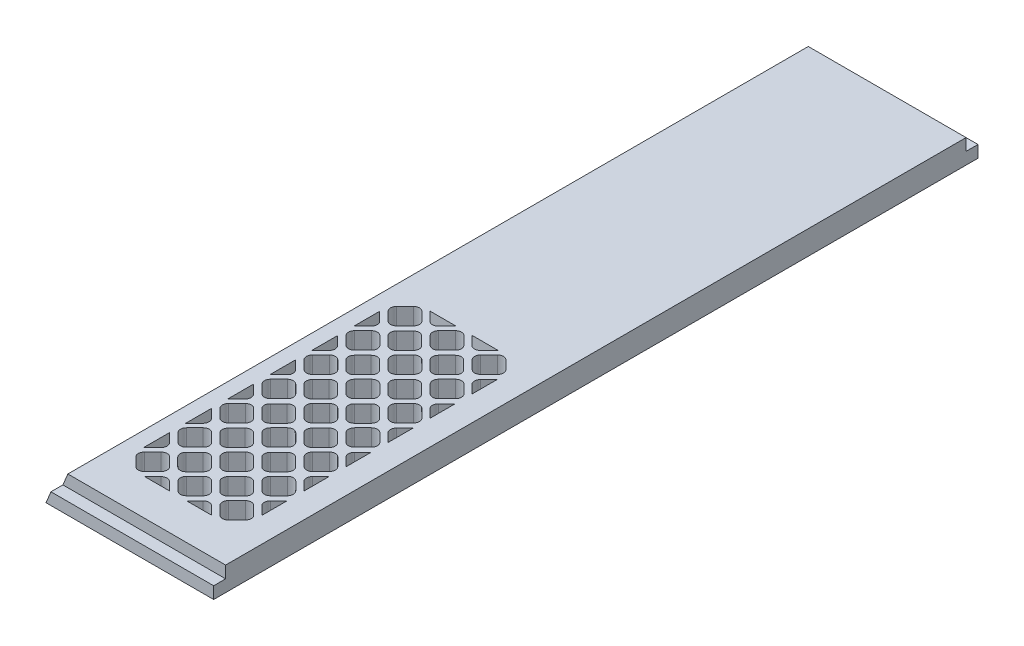
from build123d import *

# Parameters (mm, degrees)
BOSS_EXTRUDE1_DEPTH = 406.4
SKETCH2_W           = 89.154
SKETCH2_H           = 6.35
CUT_EXTRUDE1_DEPTH  = 6.35
CUT_EXTRUDE2_DEPTH  = 417.257955739


with BuildPart() as part:
    # Sketch1 → Boss-Extrude1 (new body)
    with BuildSketch(Plane.XY):
        Polygon((0, 0), (5.260512242, 12.7), (89.154, 12.7), (89.154, 0), align=None)
    extrude(amount=BOSS_EXTRUDE1_DEPTH)

    # Sketch2 → Cut-Extrude1 (cut)
    with BuildSketch(Plane.XZ.offset(-12.7)):
        with Locations((44.577, 3.175)):
            Rectangle(SKETCH2_W, SKETCH2_H)
        with Locations((44.577, 403.225)):
            Rectangle(SKETCH2_W, SKETCH2_H)
    extrude(amount=CUT_EXTRUDE1_DEPTH, mode=Mode.SUBTRACT)

    # Sketch3 → Cut-Extrude2 (cut, through all)
    with BuildSketch(Plane.XZ):
        with BuildLine():
            Line((13.244743879, 255.975205334), (13.244743879, 242.242295027))
            ThreePointArc((13.244743879, 242.242295027), (13.315448739, 242.306875127), (13.384173908, 242.37355809))
            Line((13.384173908, 242.37355809), (17.874301968, 246.863686151))
            ThreePointArc((17.874301968, 246.863686151), (18.804237938, 249.108750181), (17.874301968, 251.353814211))
            Line((17.874301968, 251.353814211), (13.384173908, 255.843942271))
            ThreePointArc((13.384173908, 255.843942271), (13.315448739, 255.910625234), (13.244743879, 255.975205334))
        make_face()
        with BuildLine():
            ThreePointArc((26.755917787, 229.001814211), (26.645338589, 228.885498635), (26.54077831, 228.763743879))
            Line((26.54077831, 228.763743879), (40.441441445, 228.763743879))
            ThreePointArc((40.441441445, 228.763743879), (40.336881166, 228.885498635), (40.226301968, 229.001814211))
            Line((40.226301968, 229.001814211), (35.736173908, 233.491942271))
            ThreePointArc((35.736173908, 233.491942271), (33.491109878, 234.421878241), (31.246045847, 233.491942271))
            Line((31.246045847, 233.491942271), (26.755917787, 229.001814211))
        make_face()
        with BuildLine():
            Line((13.244743879, 278.327205334), (13.244743879, 264.594295027))
            ThreePointArc((13.244743879, 264.594295027), (13.315448739, 264.658875127), (13.384173908, 264.72555809))
            Line((13.384173908, 264.72555809), (17.874301968, 269.215686151))
            ThreePointArc((17.874301968, 269.215686151), (18.804237938, 271.460750181), (17.874301968, 273.705814211))
            Line((17.874301968, 273.705814211), (13.384173908, 278.195942271))
            ThreePointArc((13.384173908, 278.195942271), (13.315448739, 278.262625234), (13.244743879, 278.327205334))
        make_face()
        with BuildLine():
            ThreePointArc((49.107917787, 229.001814211), (48.997338588, 228.885498635), (48.89277831, 228.763743879))
            Line((48.89277831, 228.763743879), (62.793441445, 228.763743879))
            ThreePointArc((62.793441445, 228.763743879), (62.688881166, 228.885498635), (62.578301968, 229.001814211))
            Line((62.578301968, 229.001814211), (58.088173908, 233.491942271))
            ThreePointArc((58.088173908, 233.491942271), (55.843109877, 234.421878241), (53.598045847, 233.491942271))
            Line((53.598045847, 233.491942271), (49.107917787, 229.001814211))
        make_face()
        with BuildLine():
            Line((13.244743879, 300.679205334), (13.244743879, 286.946295027))
            ThreePointArc((13.244743879, 286.946295027), (13.315448739, 287.010875127), (13.384173908, 287.07755809))
            Line((13.384173908, 287.07755809), (17.874301968, 291.56768615))
            ThreePointArc((17.874301968, 291.56768615), (18.804237938, 293.812750181), (17.874301968, 296.057814211))
            Line((17.874301968, 296.057814211), (13.384173908, 300.547942271))
            ThreePointArc((13.384173908, 300.547942271), (13.315448739, 300.614625234), (13.244743879, 300.679205334))
        make_face()
        with BuildLine():
            Line((13.244743879, 323.031205334), (13.244743879, 309.298295027))
            ThreePointArc((13.244743879, 309.298295027), (13.315448739, 309.362875127), (13.384173908, 309.42955809))
            Line((13.384173908, 309.42955809), (17.874301968, 313.91968615))
            ThreePointArc((17.874301968, 313.91968615), (18.804237938, 316.16475018), (17.874301968, 318.409814211))
            Line((17.874301968, 318.409814211), (13.384173908, 322.899942271))
            ThreePointArc((13.384173908, 322.899942271), (13.315448739, 322.966625234), (13.244743879, 323.031205334))
        make_face()
        with BuildLine():
            Line((71.459917787, 246.86368615), (75.909256121, 242.414347816))
            Line((75.909256121, 242.414347816), (75.909256121, 255.803152545))
            Line((75.909256121, 255.803152545), (71.459917787, 251.353814211))
            ThreePointArc((71.459917787, 251.353814211), (70.529981817, 249.108750181), (71.459917787, 246.86368615))
        make_face()
        with BuildLine():
            Line((13.244743879, 345.383205334), (13.244743879, 331.650295027))
            ThreePointArc((13.244743879, 331.650295027), (13.315448739, 331.714875127), (13.384173908, 331.78155809))
            Line((13.384173908, 331.78155809), (17.874301968, 336.27168615))
            ThreePointArc((17.874301968, 336.27168615), (18.804237938, 338.51675018), (17.874301968, 340.761814211))
            Line((17.874301968, 340.761814211), (13.384173908, 345.251942271))
            ThreePointArc((13.384173908, 345.251942271), (13.315448739, 345.318625234), (13.244743879, 345.383205334))
        make_face()
        with BuildLine():
            Line((71.459917786, 269.21568615), (75.909256121, 264.766347816))
            Line((75.909256121, 264.766347816), (75.909256121, 278.155152546))
            Line((75.909256121, 278.155152546), (71.459917786, 273.705814211))
            ThreePointArc((71.459917786, 273.705814211), (70.529981817, 271.460750181), (71.459917786, 269.21568615))
        make_face()
        with BuildLine():
            Line((13.244743879, 367.735205334), (13.244743879, 354.002295027))
            ThreePointArc((13.244743879, 354.002295027), (13.315448739, 354.066875126), (13.384173908, 354.13355809))
            Line((13.384173908, 354.13355809), (17.874301968, 358.62368615))
            ThreePointArc((17.874301968, 358.62368615), (18.804237938, 360.86875018), (17.874301968, 363.113814211))
            Line((17.874301968, 363.113814211), (13.384173908, 367.603942271))
            ThreePointArc((13.384173908, 367.603942271), (13.315448739, 367.670625234), (13.244743879, 367.735205334))
        make_face()
        with BuildLine():
            Line((71.459917786, 291.56768615), (75.909256121, 287.118347816))
            Line((75.909256121, 287.118347816), (75.909256121, 300.507152545))
            Line((75.909256121, 300.507152545), (71.459917786, 296.057814211))
            ThreePointArc((71.459917786, 296.057814211), (70.529981817, 293.812750181), (71.459917786, 291.56768615))
        make_face()
        with BuildLine():
            Line((71.459917786, 313.91968615), (75.909256121, 309.470347816))
            Line((75.909256121, 309.470347816), (75.909256121, 322.859152545))
            Line((75.909256121, 322.859152545), (71.459917786, 318.409814211))
            ThreePointArc((71.459917786, 318.409814211), (70.529981817, 316.164750181), (71.459917786, 313.91968615))
        make_face()
        with BuildLine():
            Line((40.086871939, 380.836256121), (26.895347816, 380.836256121))
            Line((26.895347816, 380.836256121), (31.246045847, 376.485558089))
            ThreePointArc((31.246045847, 376.485558089), (33.491109877, 375.55562212), (35.736173908, 376.485558089))
            Line((35.736173908, 376.485558089), (40.086871939, 380.836256121))
        make_face()
        with BuildLine():
            Line((71.459917787, 336.27168615), (75.909256121, 331.822347816))
            Line((75.909256121, 331.822347816), (75.909256121, 345.211152545))
            Line((75.909256121, 345.211152545), (71.459917787, 340.761814211))
            ThreePointArc((71.459917787, 340.761814211), (70.529981817, 338.51675018), (71.459917787, 336.27168615))
        make_face()
        with BuildLine():
            Line((62.438871939, 380.836256121), (49.247347815, 380.836256121))
            Line((49.247347815, 380.836256121), (53.598045847, 376.485558089))
            ThreePointArc((53.598045847, 376.485558089), (55.843109877, 375.55562212), (58.088173908, 376.485558089))
            Line((58.088173908, 376.485558089), (62.438871939, 380.836256121))
        make_face()
        with BuildLine():
            Line((71.459917787, 358.62368615), (75.909256121, 354.174347816))
            Line((75.909256121, 354.174347816), (75.909256121, 367.563152545))
            Line((75.909256121, 367.563152545), (71.459917787, 363.113814211))
            ThreePointArc((71.459917787, 363.113814211), (70.529981817, 360.86875018), (71.459917787, 358.62368615))
        make_face()
        with BuildLine():
            Line((53.598045847, 255.843942272), (49.107917787, 251.353814211))
            ThreePointArc((49.107917787, 251.353814211), (48.177981817, 249.108750181), (49.107917787, 246.863686151))
            Line((49.107917787, 246.863686151), (53.598045847, 242.37355809))
            ThreePointArc((53.598045847, 242.37355809), (55.843109877, 241.44362212), (58.088173908, 242.37355809))
            Line((58.088173908, 242.37355809), (62.578301968, 246.863686151))
            ThreePointArc((62.578301968, 246.863686151), (63.508237938, 249.108750181), (62.578301968, 251.353814211))
            Line((62.578301968, 251.353814211), (58.088173908, 255.843942272))
            ThreePointArc((58.088173908, 255.843942272), (55.843109877, 256.773878241), (53.598045847, 255.843942272))
        make_face()
        with BuildLine():
            Line((31.246045847, 255.843942272), (26.755917787, 251.353814211))
            ThreePointArc((26.755917787, 251.353814211), (25.825981817, 249.108750181), (26.755917787, 246.863686151))
            Line((26.755917787, 246.863686151), (31.246045847, 242.37355809))
            ThreePointArc((31.246045847, 242.37355809), (33.491109877, 241.44362212), (35.736173908, 242.37355809))
            Line((35.736173908, 242.37355809), (40.226301968, 246.863686151))
            ThreePointArc((40.226301968, 246.863686151), (41.156237938, 249.108750181), (40.226301968, 251.353814211))
            Line((40.226301968, 251.353814211), (35.736173908, 255.843942272))
            ThreePointArc((35.736173908, 255.843942272), (33.491109877, 256.773878241), (31.246045847, 255.843942272))
        make_face()
        with BuildLine():
            Line((53.598045847, 278.195942272), (49.107917787, 273.705814211))
            ThreePointArc((49.107917787, 273.705814211), (48.177981817, 271.460750181), (49.107917787, 269.215686151))
            Line((49.107917787, 269.215686151), (53.598045847, 264.72555809))
            ThreePointArc((53.598045847, 264.72555809), (55.843109877, 263.79562212), (58.088173908, 264.72555809))
            Line((58.088173908, 264.72555809), (62.578301968, 269.215686151))
            ThreePointArc((62.578301968, 269.215686151), (63.508237938, 271.460750181), (62.578301968, 273.705814211))
            Line((62.578301968, 273.705814211), (58.088173908, 278.195942272))
            ThreePointArc((58.088173908, 278.195942272), (55.843109877, 279.125878241), (53.598045847, 278.195942272))
        make_face()
        with BuildLine():
            Line((31.246045847, 278.195942272), (26.755917787, 273.705814211))
            ThreePointArc((26.755917787, 273.705814211), (25.825981817, 271.460750181), (26.755917787, 269.215686151))
            Line((26.755917787, 269.215686151), (31.246045847, 264.72555809))
            ThreePointArc((31.246045847, 264.72555809), (33.491109877, 263.79562212), (35.736173908, 264.72555809))
            Line((35.736173908, 264.72555809), (40.226301968, 269.215686151))
            ThreePointArc((40.226301968, 269.215686151), (41.156237938, 271.460750181), (40.226301968, 273.705814211))
            Line((40.226301968, 273.705814211), (35.736173908, 278.195942272))
            ThreePointArc((35.736173908, 278.195942272), (33.491109877, 279.125878241), (31.246045847, 278.195942272))
        make_face()
        with BuildLine():
            Line((53.598045847, 300.547942271), (49.107917787, 296.057814211))
            ThreePointArc((49.107917787, 296.057814211), (48.177981817, 293.812750181), (49.107917787, 291.56768615))
            Line((49.107917787, 291.56768615), (53.598045847, 287.07755809))
            ThreePointArc((53.598045847, 287.07755809), (55.843109877, 286.14762212), (58.088173908, 287.07755809))
            Line((58.088173908, 287.07755809), (62.578301968, 291.56768615))
            ThreePointArc((62.578301968, 291.56768615), (63.508237938, 293.812750181), (62.578301968, 296.057814211))
            Line((62.578301968, 296.057814211), (58.088173908, 300.547942271))
            ThreePointArc((58.088173908, 300.547942271), (55.843109877, 301.477878241), (53.598045847, 300.547942271))
        make_face()
        with BuildLine():
            Line((31.246045847, 300.547942271), (26.755917787, 296.057814211))
            ThreePointArc((26.755917787, 296.057814211), (25.825981817, 293.812750181), (26.755917787, 291.56768615))
            Line((26.755917787, 291.56768615), (31.246045847, 287.07755809))
            ThreePointArc((31.246045847, 287.07755809), (33.491109877, 286.14762212), (35.736173908, 287.07755809))
            Line((35.736173908, 287.07755809), (40.226301968, 291.56768615))
            ThreePointArc((40.226301968, 291.56768615), (41.156237938, 293.812750181), (40.226301968, 296.057814211))
            Line((40.226301968, 296.057814211), (35.736173908, 300.547942271))
            ThreePointArc((35.736173908, 300.547942271), (33.491109877, 301.477878241), (31.246045847, 300.547942271))
        make_face()
        with BuildLine():
            Line((53.598045847, 322.899942271), (49.107917787, 318.409814211))
            ThreePointArc((49.107917787, 318.409814211), (48.177981817, 316.164750181), (49.107917787, 313.91968615))
            Line((49.107917787, 313.91968615), (53.598045847, 309.42955809))
            ThreePointArc((53.598045847, 309.42955809), (55.843109877, 308.49962212), (58.088173908, 309.42955809))
            Line((58.088173908, 309.42955809), (62.578301968, 313.91968615))
            ThreePointArc((62.578301968, 313.91968615), (63.508237938, 316.164750181), (62.578301968, 318.409814211))
            Line((62.578301968, 318.409814211), (58.088173908, 322.899942271))
            ThreePointArc((58.088173908, 322.899942271), (55.843109877, 323.829878241), (53.598045847, 322.899942271))
        make_face()
        with BuildLine():
            Line((31.246045847, 322.899942271), (26.755917787, 318.409814211))
            ThreePointArc((26.755917787, 318.409814211), (25.825981817, 316.164750181), (26.755917787, 313.91968615))
            Line((26.755917787, 313.91968615), (31.246045847, 309.42955809))
            ThreePointArc((31.246045847, 309.42955809), (33.491109877, 308.49962212), (35.736173908, 309.42955809))
            Line((35.736173908, 309.42955809), (40.226301968, 313.91968615))
            ThreePointArc((40.226301968, 313.91968615), (41.156237938, 316.164750181), (40.226301968, 318.409814211))
            Line((40.226301968, 318.409814211), (35.736173908, 322.899942271))
            ThreePointArc((35.736173908, 322.899942271), (33.491109877, 323.829878241), (31.246045847, 322.899942271))
        make_face()
        with BuildLine():
            Line((53.598045847, 345.251942271), (49.107917787, 340.761814211))
            ThreePointArc((49.107917787, 340.761814211), (48.177981817, 338.51675018), (49.107917787, 336.27168615))
            Line((49.107917787, 336.27168615), (53.598045847, 331.78155809))
            ThreePointArc((53.598045847, 331.78155809), (55.843109877, 330.85162212), (58.088173908, 331.78155809))
            Line((58.088173908, 331.78155809), (62.578301968, 336.27168615))
            ThreePointArc((62.578301968, 336.27168615), (63.508237938, 338.51675018), (62.578301968, 340.761814211))
            Line((62.578301968, 340.761814211), (58.088173908, 345.251942271))
            ThreePointArc((58.088173908, 345.251942271), (55.843109877, 346.181878241), (53.598045847, 345.251942271))
        make_face()
        with BuildLine():
            Line((31.246045847, 345.251942271), (26.755917787, 340.761814211))
            ThreePointArc((26.755917787, 340.761814211), (25.825981817, 338.51675018), (26.755917787, 336.27168615))
            Line((26.755917787, 336.27168615), (31.246045847, 331.78155809))
            ThreePointArc((31.246045847, 331.78155809), (33.491109877, 330.85162212), (35.736173908, 331.78155809))
            Line((35.736173908, 331.78155809), (40.226301968, 336.27168615))
            ThreePointArc((40.226301968, 336.27168615), (41.156237938, 338.51675018), (40.226301968, 340.761814211))
            Line((40.226301968, 340.761814211), (35.736173908, 345.251942271))
            ThreePointArc((35.736173908, 345.251942271), (33.491109877, 346.181878241), (31.246045847, 345.251942271))
        make_face()
        with BuildLine():
            Line((53.598045847, 367.603942271), (49.107917787, 363.113814211))
            ThreePointArc((49.107917787, 363.113814211), (48.177981817, 360.86875018), (49.107917787, 358.62368615))
            Line((49.107917787, 358.62368615), (53.598045847, 354.13355809))
            ThreePointArc((53.598045847, 354.13355809), (55.843109877, 353.20362212), (58.088173908, 354.13355809))
            Line((58.088173908, 354.13355809), (62.578301968, 358.62368615))
            ThreePointArc((62.578301968, 358.62368615), (63.508237938, 360.86875018), (62.578301968, 363.113814211))
            Line((62.578301968, 363.113814211), (58.088173908, 367.603942271))
            ThreePointArc((58.088173908, 367.603942271), (55.843109877, 368.533878241), (53.598045847, 367.603942271))
        make_face()
        with BuildLine():
            Line((31.246045847, 367.603942271), (26.755917787, 363.113814211))
            ThreePointArc((26.755917787, 363.113814211), (25.825981817, 360.86875018), (26.755917787, 358.62368615))
            Line((26.755917787, 358.62368615), (31.246045847, 354.13355809))
            ThreePointArc((31.246045847, 354.13355809), (33.491109877, 353.20362212), (35.736173908, 354.13355809))
            Line((35.736173908, 354.13355809), (40.226301968, 358.62368615))
            ThreePointArc((40.226301968, 358.62368615), (41.156237938, 360.86875018), (40.226301968, 363.113814211))
            Line((40.226301968, 363.113814211), (35.736173908, 367.603942271))
            ThreePointArc((35.736173908, 367.603942271), (33.491109877, 368.533878241), (31.246045847, 367.603942271))
        make_face()
        with BuildLine():
            Line((69.17406403, 231.008807909), (73.664192091, 235.49893597))
            ThreePointArc((73.664192091, 235.49893597), (74.594128061, 237.744), (73.664192091, 239.98906403))
            Line((73.664192091, 239.98906403), (69.17406403, 244.479192091))
            ThreePointArc((69.17406403, 244.479192091), (66.929, 245.409128061), (64.68393597, 244.479192091))
            Line((64.68393597, 244.479192091), (60.193807909, 239.98906403))
            ThreePointArc((60.193807909, 239.98906403), (59.263871939, 237.744), (60.193807909, 235.49893597))
            Line((60.193807909, 235.49893597), (64.68393597, 231.008807909))
            ThreePointArc((64.68393597, 231.008807909), (66.929, 230.078871939), (69.17406403, 231.008807909))
        make_face()
        with BuildLine():
            Line((46.82206403, 231.008807909), (51.312192091, 235.49893597))
            ThreePointArc((51.312192091, 235.49893597), (52.242128061, 237.744), (51.312192091, 239.98906403))
            Line((51.312192091, 239.98906403), (46.82206403, 244.479192091))
            ThreePointArc((46.82206403, 244.479192091), (44.577, 245.409128061), (42.33193597, 244.479192091))
            Line((42.33193597, 244.479192091), (37.841807909, 239.98906403))
            ThreePointArc((37.841807909, 239.98906403), (36.911871939, 237.744), (37.841807909, 235.49893597))
            Line((37.841807909, 235.49893597), (42.33193597, 231.008807909))
            ThreePointArc((42.33193597, 231.008807909), (44.577, 230.078871939), (46.82206403, 231.008807909))
        make_face()
        with BuildLine():
            Line((24.47006403, 231.008807909), (28.960192091, 235.49893597))
            ThreePointArc((28.960192091, 235.49893597), (29.890128061, 237.744), (28.960192091, 239.98906403))
            Line((28.960192091, 239.98906403), (24.47006403, 244.479192091))
            ThreePointArc((24.47006403, 244.479192091), (22.225, 245.409128061), (19.97993597, 244.479192091))
            Line((19.97993597, 244.479192091), (15.489807909, 239.98906403))
            ThreePointArc((15.489807909, 239.98906403), (14.559871939, 237.744), (15.489807909, 235.49893597))
            Line((15.489807909, 235.49893597), (19.97993597, 231.008807909))
            ThreePointArc((19.97993597, 231.008807909), (22.225, 230.078871939), (24.47006403, 231.008807909))
        make_face()
        with BuildLine():
            Line((69.17406403, 253.360807909), (73.664192091, 257.85093597))
            ThreePointArc((73.664192091, 257.85093597), (74.594128061, 260.096), (73.664192091, 262.34106403))
            Line((73.664192091, 262.34106403), (69.17406403, 266.831192091))
            ThreePointArc((69.17406403, 266.831192091), (66.929, 267.761128061), (64.68393597, 266.831192091))
            Line((64.68393597, 266.831192091), (60.193807909, 262.34106403))
            ThreePointArc((60.193807909, 262.34106403), (59.263871939, 260.096), (60.193807909, 257.85093597))
            Line((60.193807909, 257.85093597), (64.68393597, 253.360807909))
            ThreePointArc((64.68393597, 253.360807909), (66.929, 252.430871939), (69.17406403, 253.360807909))
        make_face()
        with BuildLine():
            Line((46.82206403, 253.360807909), (51.312192091, 257.85093597))
            ThreePointArc((51.312192091, 257.85093597), (52.242128061, 260.096), (51.312192091, 262.34106403))
            Line((51.312192091, 262.34106403), (46.82206403, 266.831192091))
            ThreePointArc((46.82206403, 266.831192091), (44.577, 267.761128061), (42.33193597, 266.831192091))
            Line((42.33193597, 266.831192091), (37.841807909, 262.34106403))
            ThreePointArc((37.841807909, 262.34106403), (36.911871939, 260.096), (37.841807909, 257.85093597))
            Line((37.841807909, 257.85093597), (42.33193597, 253.360807909))
            ThreePointArc((42.33193597, 253.360807909), (44.577, 252.430871939), (46.82206403, 253.360807909))
        make_face()
        with BuildLine():
            Line((24.47006403, 253.360807909), (28.960192091, 257.85093597))
            ThreePointArc((28.960192091, 257.85093597), (29.890128061, 260.096), (28.960192091, 262.34106403))
            Line((28.960192091, 262.34106403), (24.47006403, 266.831192091))
            ThreePointArc((24.47006403, 266.831192091), (22.225, 267.761128061), (19.97993597, 266.831192091))
            Line((19.97993597, 266.831192091), (15.489807909, 262.34106403))
            ThreePointArc((15.489807909, 262.34106403), (14.559871939, 260.096), (15.489807909, 257.85093597))
            Line((15.489807909, 257.85093597), (19.97993597, 253.360807909))
            ThreePointArc((19.97993597, 253.360807909), (22.225, 252.430871939), (24.47006403, 253.360807909))
        make_face()
        with BuildLine():
            Line((69.17406403, 275.712807909), (73.664192091, 280.20293597))
            ThreePointArc((73.664192091, 280.20293597), (74.594128061, 282.448), (73.664192091, 284.69306403))
            Line((73.664192091, 284.69306403), (69.17406403, 289.183192091))
            ThreePointArc((69.17406403, 289.183192091), (66.929, 290.113128061), (64.68393597, 289.183192091))
            Line((64.68393597, 289.183192091), (60.193807909, 284.69306403))
            ThreePointArc((60.193807909, 284.69306403), (59.263871939, 282.448), (60.193807909, 280.20293597))
            Line((60.193807909, 280.20293597), (64.68393597, 275.712807909))
            ThreePointArc((64.68393597, 275.712807909), (66.929, 274.782871939), (69.17406403, 275.712807909))
        make_face()
        with BuildLine():
            Line((46.82206403, 275.712807909), (51.312192091, 280.20293597))
            ThreePointArc((51.312192091, 280.20293597), (52.242128061, 282.448), (51.312192091, 284.69306403))
            Line((51.312192091, 284.69306403), (46.82206403, 289.183192091))
            ThreePointArc((46.82206403, 289.183192091), (44.577, 290.113128061), (42.33193597, 289.183192091))
            Line((42.33193597, 289.183192091), (37.841807909, 284.69306403))
            ThreePointArc((37.841807909, 284.69306403), (36.911871939, 282.448), (37.841807909, 280.20293597))
            Line((37.841807909, 280.20293597), (42.33193597, 275.712807909))
            ThreePointArc((42.33193597, 275.712807909), (44.577, 274.782871939), (46.82206403, 275.712807909))
        make_face()
        with BuildLine():
            Line((24.47006403, 275.712807909), (28.960192091, 280.20293597))
            ThreePointArc((28.960192091, 280.20293597), (29.890128061, 282.448), (28.960192091, 284.69306403))
            Line((28.960192091, 284.69306403), (24.47006403, 289.183192091))
            ThreePointArc((24.47006403, 289.183192091), (22.225, 290.113128061), (19.97993597, 289.183192091))
            Line((19.97993597, 289.183192091), (15.489807909, 284.69306403))
            ThreePointArc((15.489807909, 284.69306403), (14.559871939, 282.448), (15.489807909, 280.20293597))
            Line((15.489807909, 280.20293597), (19.97993597, 275.712807909))
            ThreePointArc((19.97993597, 275.712807909), (22.225, 274.782871939), (24.47006403, 275.712807909))
        make_face()
        with BuildLine():
            Line((69.17406403, 298.064807909), (73.664192091, 302.55493597))
            ThreePointArc((73.664192091, 302.55493597), (74.594128061, 304.8), (73.664192091, 307.04506403))
            Line((73.664192091, 307.04506403), (69.17406403, 311.535192091))
            ThreePointArc((69.17406403, 311.535192091), (66.929, 312.465128061), (64.68393597, 311.535192091))
            Line((64.68393597, 311.535192091), (60.193807909, 307.04506403))
            ThreePointArc((60.193807909, 307.04506403), (59.263871939, 304.8), (60.193807909, 302.55493597))
            Line((60.193807909, 302.55493597), (64.68393597, 298.064807909))
            ThreePointArc((64.68393597, 298.064807909), (66.929, 297.134871939), (69.17406403, 298.064807909))
        make_face()
        with BuildLine():
            Line((46.82206403, 298.064807909), (51.312192091, 302.55493597))
            ThreePointArc((51.312192091, 302.55493597), (52.242128061, 304.8), (51.312192091, 307.04506403))
            Line((51.312192091, 307.04506403), (46.82206403, 311.535192091))
            ThreePointArc((46.82206403, 311.535192091), (44.577, 312.465128061), (42.33193597, 311.535192091))
            Line((42.33193597, 311.535192091), (37.841807909, 307.04506403))
            ThreePointArc((37.841807909, 307.04506403), (36.911871939, 304.8), (37.841807909, 302.55493597))
            Line((37.841807909, 302.55493597), (42.33193597, 298.064807909))
            ThreePointArc((42.33193597, 298.064807909), (44.577, 297.134871939), (46.82206403, 298.064807909))
        make_face()
        with BuildLine():
            Line((24.47006403, 298.064807909), (28.960192091, 302.55493597))
            ThreePointArc((28.960192091, 302.55493597), (29.890128061, 304.8), (28.960192091, 307.04506403))
            Line((28.960192091, 307.04506403), (24.47006403, 311.535192091))
            ThreePointArc((24.47006403, 311.535192091), (22.225, 312.465128061), (19.97993597, 311.535192091))
            Line((19.97993597, 311.535192091), (15.489807909, 307.04506403))
            ThreePointArc((15.489807909, 307.04506403), (14.559871939, 304.8), (15.489807909, 302.55493597))
            Line((15.489807909, 302.55493597), (19.97993597, 298.064807909))
            ThreePointArc((19.97993597, 298.064807909), (22.225, 297.134871939), (24.47006403, 298.064807909))
        make_face()
        with BuildLine():
            Line((69.17406403, 320.416807909), (73.664192091, 324.90693597))
            ThreePointArc((73.664192091, 324.90693597), (74.594128061, 327.152), (73.664192091, 329.39706403))
            Line((73.664192091, 329.39706403), (69.17406403, 333.887192091))
            ThreePointArc((69.17406403, 333.887192091), (66.929, 334.817128061), (64.68393597, 333.887192091))
            Line((64.68393597, 333.887192091), (60.193807909, 329.39706403))
            ThreePointArc((60.193807909, 329.39706403), (59.263871939, 327.152), (60.193807909, 324.90693597))
            Line((60.193807909, 324.90693597), (64.68393597, 320.416807909))
            ThreePointArc((64.68393597, 320.416807909), (66.929, 319.486871939), (69.17406403, 320.416807909))
        make_face()
        with BuildLine():
            Line((46.82206403, 320.416807909), (51.312192091, 324.90693597))
            ThreePointArc((51.312192091, 324.90693597), (52.242128061, 327.152), (51.312192091, 329.39706403))
            Line((51.312192091, 329.39706403), (46.82206403, 333.887192091))
            ThreePointArc((46.82206403, 333.887192091), (44.577, 334.817128061), (42.33193597, 333.887192091))
            Line((42.33193597, 333.887192091), (37.841807909, 329.39706403))
            ThreePointArc((37.841807909, 329.39706403), (36.911871939, 327.152), (37.841807909, 324.90693597))
            Line((37.841807909, 324.90693597), (42.33193597, 320.416807909))
            ThreePointArc((42.33193597, 320.416807909), (44.577, 319.486871939), (46.82206403, 320.416807909))
        make_face()
        with BuildLine():
            Line((24.47006403, 320.416807909), (28.960192091, 324.90693597))
            ThreePointArc((28.960192091, 324.90693597), (29.890128061, 327.152), (28.960192091, 329.39706403))
            Line((28.960192091, 329.39706403), (24.47006403, 333.887192091))
            ThreePointArc((24.47006403, 333.887192091), (22.225, 334.817128061), (19.97993597, 333.887192091))
            Line((19.97993597, 333.887192091), (15.489807909, 329.39706403))
            ThreePointArc((15.489807909, 329.39706403), (14.559871939, 327.152), (15.489807909, 324.90693597))
            Line((15.489807909, 324.90693597), (19.97993597, 320.416807909))
            ThreePointArc((19.97993597, 320.416807909), (22.225, 319.486871939), (24.47006403, 320.416807909))
        make_face()
        with BuildLine():
            Line((69.17406403, 342.768807909), (73.664192091, 347.25893597))
            ThreePointArc((73.664192091, 347.25893597), (74.594128061, 349.504), (73.664192091, 351.74906403))
            Line((73.664192091, 351.74906403), (69.17406403, 356.239192091))
            ThreePointArc((69.17406403, 356.239192091), (66.929, 357.169128061), (64.68393597, 356.239192091))
            Line((64.68393597, 356.239192091), (60.193807909, 351.74906403))
            ThreePointArc((60.193807909, 351.74906403), (59.263871939, 349.504), (60.193807909, 347.25893597))
            Line((60.193807909, 347.25893597), (64.68393597, 342.768807909))
            ThreePointArc((64.68393597, 342.768807909), (66.929, 341.838871939), (69.17406403, 342.768807909))
        make_face()
        with BuildLine():
            Line((46.82206403, 342.768807909), (51.312192091, 347.25893597))
            ThreePointArc((51.312192091, 347.25893597), (52.242128061, 349.504), (51.312192091, 351.74906403))
            Line((51.312192091, 351.74906403), (46.82206403, 356.239192091))
            ThreePointArc((46.82206403, 356.239192091), (44.577, 357.169128061), (42.33193597, 356.239192091))
            Line((42.33193597, 356.239192091), (37.841807909, 351.74906403))
            ThreePointArc((37.841807909, 351.74906403), (36.911871939, 349.504), (37.841807909, 347.25893597))
            Line((37.841807909, 347.25893597), (42.33193597, 342.768807909))
            ThreePointArc((42.33193597, 342.768807909), (44.577, 341.838871939), (46.82206403, 342.768807909))
        make_face()
        with BuildLine():
            Line((24.47006403, 342.768807909), (28.960192091, 347.25893597))
            ThreePointArc((28.960192091, 347.25893597), (29.890128061, 349.504), (28.960192091, 351.74906403))
            Line((28.960192091, 351.74906403), (24.47006403, 356.239192091))
            ThreePointArc((24.47006403, 356.239192091), (22.225, 357.169128061), (19.97993597, 356.239192091))
            Line((19.97993597, 356.239192091), (15.489807909, 351.74906403))
            ThreePointArc((15.489807909, 351.74906403), (14.559871939, 349.504), (15.489807909, 347.25893597))
            Line((15.489807909, 347.25893597), (19.97993597, 342.768807909))
            ThreePointArc((19.97993597, 342.768807909), (22.225, 341.838871939), (24.47006403, 342.768807909))
        make_face()
        with BuildLine():
            Line((69.17406403, 365.120807909), (73.664192091, 369.61093597))
            ThreePointArc((73.664192091, 369.61093597), (74.594128061, 371.856), (73.664192091, 374.10106403))
            Line((73.664192091, 374.10106403), (69.17406403, 378.591192091))
            ThreePointArc((69.17406403, 378.591192091), (66.929, 379.521128061), (64.68393597, 378.591192091))
            Line((64.68393597, 378.591192091), (60.193807909, 374.10106403))
            ThreePointArc((60.193807909, 374.10106403), (59.263871939, 371.856), (60.193807909, 369.61093597))
            Line((60.193807909, 369.61093597), (64.68393597, 365.120807909))
            ThreePointArc((64.68393597, 365.120807909), (66.929, 364.190871939), (69.17406403, 365.120807909))
        make_face()
        with BuildLine():
            Line((46.82206403, 365.120807909), (51.312192091, 369.61093597))
            ThreePointArc((51.312192091, 369.61093597), (52.242128061, 371.856), (51.312192091, 374.10106403))
            Line((51.312192091, 374.10106403), (46.82206403, 378.591192091))
            ThreePointArc((46.82206403, 378.591192091), (44.577, 379.521128061), (42.33193597, 378.591192091))
            Line((42.33193597, 378.591192091), (37.841807909, 374.10106403))
            ThreePointArc((37.841807909, 374.10106403), (36.911871939, 371.856), (37.841807909, 369.61093597))
            Line((37.841807909, 369.61093597), (42.33193597, 365.120807909))
            ThreePointArc((42.33193597, 365.120807909), (44.577, 364.190871939), (46.82206403, 365.120807909))
        make_face()
        with BuildLine():
            Line((15.489807909, 369.61093597), (19.97993597, 365.120807909))
            ThreePointArc((19.97993597, 365.120807909), (22.225, 364.190871939), (24.47006403, 365.120807909))
            Line((24.47006403, 365.120807909), (28.960192091, 369.61093597))
            ThreePointArc((28.960192091, 369.61093597), (29.890128061, 371.856), (28.960192091, 374.10106403))
            Line((28.960192091, 374.10106403), (24.47006403, 378.591192091))
            ThreePointArc((24.47006403, 378.591192091), (22.225, 379.521128061), (19.97993597, 378.591192091))
            Line((19.97993597, 378.591192091), (15.489807909, 374.10106403))
            ThreePointArc((15.489807909, 374.10106403), (14.559871939, 371.856), (15.489807909, 369.61093597))
        make_face()
    extrude(amount=-CUT_EXTRUDE2_DEPTH, mode=Mode.SUBTRACT)


solid = part.part
